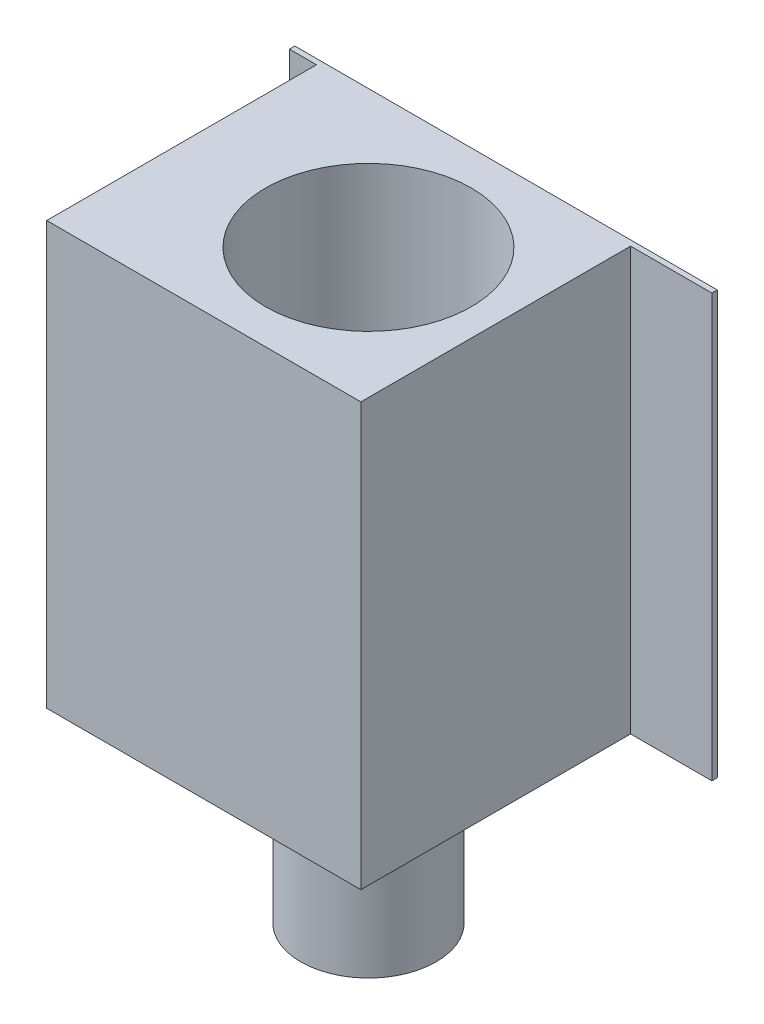
from build123d import *

# Parameters (mm, degrees)
SKETCH_1_W          = 7.8
SKETCH_1_H          = 5.08
EXTRUDE_1_DEPTH     = 7.8
SKETCH_2_R          = 1.9
CUT_EXTRUDE_1_DEPTH = 4.2
SKETCH_3_W          = 2.509058382
SKETCH_3_H          = 0.614954654
CUT_EXTRUDE_2_DEPTH = 0.5
SKETCH_4_R          = 1.25
EXTRUDE_1_2_DEPTH   = 3
SKETCH_5_W          = 0.5
SKETCH_5_H          = 4.98
SKETCH_5_W_2        = 1.5
CUT_EXTRUDE_3_DEPTH = 12.760170067


with BuildPart() as part:
    # 草图1 → Extrude 1 (new body)
    with BuildSketch(Plane(origin=(0, 0, 0), x_dir=(1, 0, 0), z_dir=(0, 1, 0))):
        Rectangle(SKETCH_1_W, SKETCH_1_H)
    extrude(amount=EXTRUDE_1_DEPTH)

    # 草图2 → 切除-拉伸1 (cut)
    with BuildSketch(Plane(origin=(0, 7.8, 0), x_dir=(1, 0, 0), z_dir=(0, 1, 0))):
        Circle(SKETCH_2_R)
    extrude(amount=-CUT_EXTRUDE_1_DEPTH, mode=Mode.SUBTRACT)

    # 草图3 → 切除-拉伸2 (cut)
    with BuildSketch(Plane(origin=(0, 3.6, 0), x_dir=(1, 0, 0), z_dir=(0, 1, 0))):
        Rectangle(SKETCH_3_W, SKETCH_3_H)
    extrude(amount=-CUT_EXTRUDE_2_DEPTH, mode=Mode.SUBTRACT)

    # 草图4 → Extrude 1 2 (add)
    with BuildSketch(Plane.XZ):
        Circle(SKETCH_4_R)
    extrude(amount=EXTRUDE_1_2_DEPTH)

    # 草图5 → 切除-拉伸3 (cut, through all)
    with BuildSketch(Plane(origin=(0, 7.8, 0), x_dir=(1, 0, 0), z_dir=(0, 1, 0))):
        with Locations((-3.65, -0.05)):
            Rectangle(SKETCH_5_W, SKETCH_5_H)
        with Locations((3.15, -0.05)):
            Rectangle(SKETCH_5_W_2, SKETCH_5_H)
    extrude(amount=-CUT_EXTRUDE_3_DEPTH, mode=Mode.SUBTRACT)


solid = part.part
